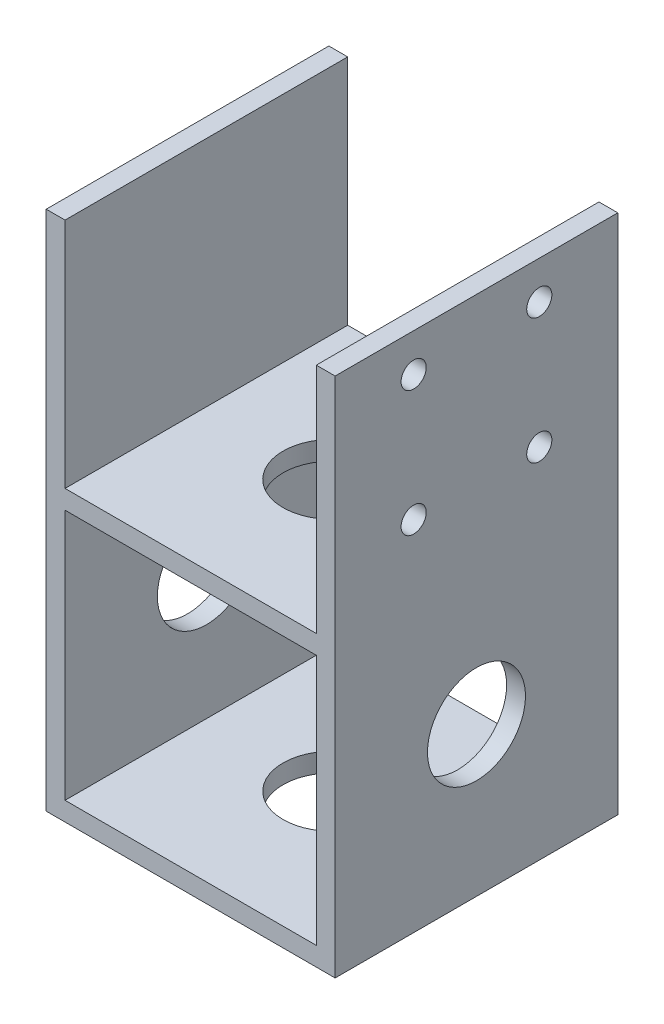
from build123d import *

# Parameters (mm, degrees)
SKETCH1_W           = 46
SKETCH1_H           = 45
BOSS_EXTRUDE1_DEPTH = 3
SKETCH5_W           = 3
SKETCH5_H           = 45
BOSS_EXTRUDE3_DEPTH = 35
SKETCH9_R           = 7.8
CUT_EXTRUDE5_DEPTH  = 10
SKETCH11_R          = 7.8
CUT_EXTRUDE8_DEPTH  = 64.767154555
SKETCH12_W          = 3
SKETCH12_H          = 45
BOSS_EXTRUDE4_DEPTH = 45
SKETCH13_R          = 2
CUT_EXTRUDE9_DEPTH  = 10


with BuildPart() as part:
    # Sketch1 → Boss-Extrude1 (new body)
    with BuildSketch(Plane(origin=(0, 0, 0), x_dir=(1, 0, 0), z_dir=(0, 1, 0))):
        Rectangle(SKETCH1_W, SKETCH1_H)
    boss_extrude1 = extrude(amount=BOSS_EXTRUDE1_DEPTH)

    # Sketch5 → Boss-Extrude3 (add)
    with BuildSketch(Plane(origin=(0, 3, 0), x_dir=(1, 0, 0), z_dir=(0, 1, 0))):
        with Locations((21.5, 0)):
            Rectangle(SKETCH5_W, SKETCH5_H)
        with Locations((-21.5, 0)):
            Rectangle(SKETCH5_W, SKETCH5_H)
    extrude(amount=BOSS_EXTRUDE3_DEPTH)

    # Sketch9 → Cut-Extrude5 (cut)
    with BuildSketch(Plane(origin=(0, 3, 0), x_dir=(1, 0, 0), z_dir=(0, 1, 0))):
        Circle(SKETCH9_R)
    cut_extrude5 = extrude(amount=-CUT_EXTRUDE5_DEPTH, mode=Mode.SUBTRACT)

    # Sketch11 → Cut-Extrude8 (cut, through all)
    with BuildSketch(Plane.ZY.offset(23)):
        with Locations((0, 23.75)):
            Circle(SKETCH11_R)
    extrude(amount=-CUT_EXTRUDE8_DEPTH, mode=Mode.SUBTRACT)

    # Sketch12 → Boss-Extrude4 (add)
    with BuildSketch(Plane(origin=(0, 38, 0), x_dir=(1, 0, 0), z_dir=(0, 1, 0))):
        with Locations((-21.5, 0)):
            Rectangle(SKETCH12_W, SKETCH12_H)
        with Locations((21.5, 0)):
            Rectangle(SKETCH12_W, SKETCH12_H)
    extrude(amount=BOSS_EXTRUDE4_DEPTH)

    # Sketch13 → Cut-Extrude9 (cut)
    with BuildSketch(Plane(origin=(23, 0, 0), x_dir=(0, 0, -1), z_dir=(1, 0, 0))):
        with Locations((-10, 76.955662999)):
            Circle(SKETCH13_R)
        with Locations((10, 76.955662999)):
            Circle(SKETCH13_R)
        with Locations((10, 56.955662999)):
            Circle(SKETCH13_R)
        with Locations((-10, 56.955662999)):
            Circle(SKETCH13_R)
    extrude(amount=-CUT_EXTRUDE9_DEPTH, mode=Mode.SUBTRACT)

    # Mirror1: Boss-Extrude1, Cut-Extrude5 across plane
    add(boss_extrude1.mirror(Plane.ZX.offset(23)))
    add(cut_extrude5.mirror(Plane.ZX.offset(23)), mode=Mode.SUBTRACT)


solid = part.part
